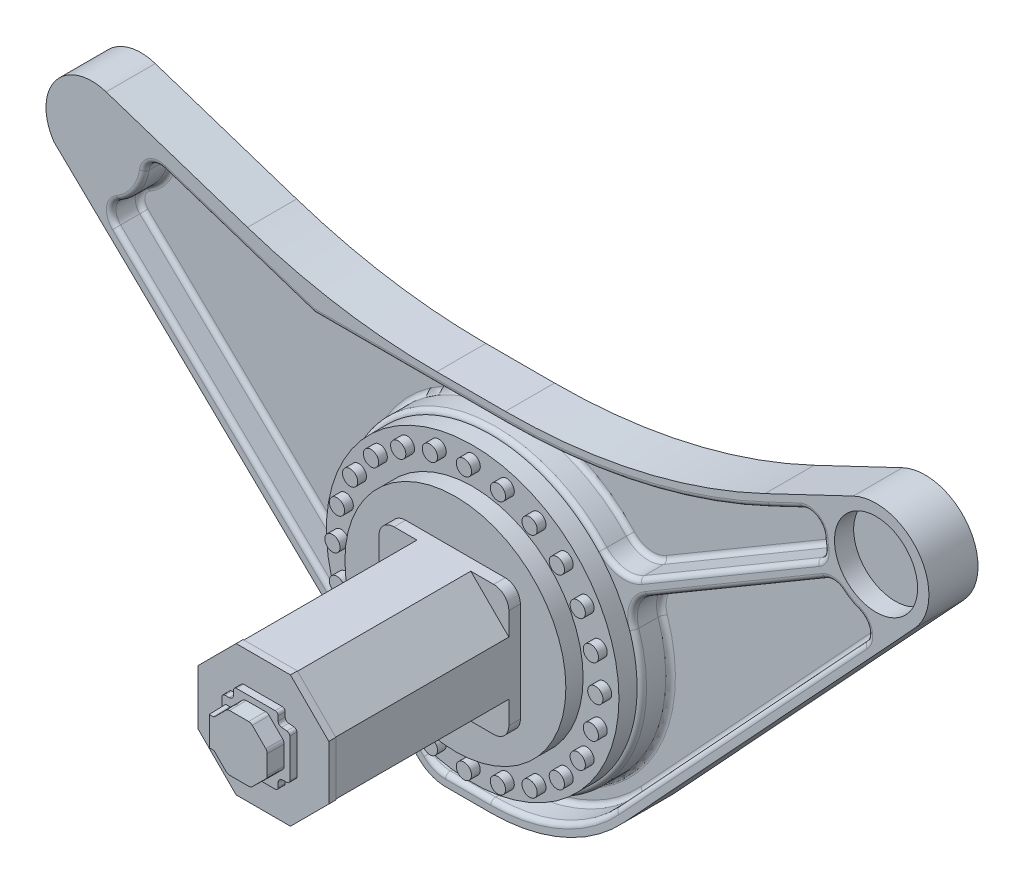
from build123d import *

# Parameters (mm, degrees)
BASE_EXTRUDE_DEPTH  = 65.024
CUT_EXTRUDE1_DEPTH  = 38.1
FILLET5_R           = 6.35
SKETCH6_R           = 193.675
BOSS_EXTRUDE1_DEPTH = 24.003
SKETCH7_R           = 146.26779464
BOSS_EXTRUDE2_DEPTH = 22.86
SKETCH11_R          = 55
CUT_EXTRUDE2_DEPTH  = 25.4
BOSS_EXTRUDE3_DEPTH = 15.24
BOSS_EXTRUDE4_DEPTH = 229.87
BOSS_EXTRUDE5_DEPTH = 9.2075
EXTRUDE1_DEPTH      = 9.365
EXTRUDE2_DEPTH      = 22.065
EXTRUDE2_DRAFT      = 1
SKETCH16_R          = 10.091495507
EXTRUDE3_DEPTH      = 11.5875


with BuildPart() as part:
    # Sketch4 → Base-Extrude (new body)
    with BuildSketch(Plane.XY):
        with BuildLine():
            Line((479.92086318, 363.207848646), (363.117312377, 307.623715754))
            ThreePointArc((363.117312377, 307.623715754), (195.563611931, 249.647162562), (19.354896086, 229.999981764))
            Line((19.354896086, 229.999981764), (-71.479066693, 229.999992346))
            ThreePointArc((-71.479066693, 229.999992346), (-198.372903258, 240.12789288), (-322.053822344, 270.255129416))
            Line((-322.053822344, 270.255129416), (-509.206847717, 331.980893447))
            ThreePointArc((-509.206847717, 331.980893447), (-576.71190566, 310.78827653), (-578.200740734, 240.050427892))
            Line((-578.200740734, 240.050427892), (-94.52402, -226.00512))
            ThreePointArc((-94.52402, -226.00512), (-78.535495562, -236.369472827), (-59.83063, -240))
            Line((-59.83063, -240), (0, -239.99999925))
            ThreePointArc((0, -239.99999925), (96.011991662, -219.958397661), (175.9887, -163.18081))
            Line((175.9887, -163.18081), (422.948954749, 103.163092303))
            Line((422.948954749, 103.163092303), (561.330058706, 252.405581829))
            ThreePointArc((561.330058706, 252.405581829), (566.410907567, 341.446427525), (479.92086318, 363.207848646))
        make_face()
    extrude(amount=-BASE_EXTRUDE_DEPTH)

    # Sketch5 → Cut-Extrude1 (cut)
    with BuildSketch(Plane.XY):
        with BuildLine():
            Line((-234.33637, 214.999997885), (19.354821885, 214.999997885))
            ThreePointArc((19.354821885, 214.999997885), (198.867420254, 235.015579287), (369.562720073, 294.079198307))
            Line((369.562720073, 294.079198307), (411.406245314, 313.991576975))
            ThreePointArc((411.406245314, 313.991576975), (430.352119032, 313.079278529), (440.073584256, 296.79211999))
            ThreePointArc((440.073584256, 296.79211999), (440.491819332, 291.71703301), (441.277901085, 286.685780292))
            ThreePointArc((441.277901085, 286.685780292), (439.868596399, 274.616540113), (431.75206941, 265.573604317))
            Line((431.75206941, 265.573604317), (197.134447916, 127.563319093))
            ThreePointArc((197.134447916, 127.563319093), (170.99853328, 122.498951147), (147.499655256, 135.010409423))
            ThreePointArc((147.499655256, 135.010409423), (-172.352272318, -101.383715715), (189.668329848, 63.323665965))
            ThreePointArc((189.668329848, 63.323665965), (190.150056495, 89.941362702), (207.274921456, 110.324513593))
            Line((207.274921456, 110.324513593), (441.93265, 248.35857))
            ThreePointArc((441.93265, 248.35857), (453.746209565, 251.049780264), (464.945711016, 246.426581209))
            ThreePointArc((464.945711016, 246.426581209), (474.991929524, 239.382873677), (486.113685369, 234.201477242))
            ThreePointArc((486.113685369, 234.201477242), (498.727804097, 220.106539526), (493.954743365, 201.803502844))
            Line((493.954743365, 201.803502844), (164.98941, -152.98201))
            ThreePointArc((164.98941, -152.98201), (90.011245295, -206.211001908), (0, -225.000000884))
            Line((0, -225.000000884), (-59.861446701, -224.99999781))
            ThreePointArc((-59.861446701, -224.99999781), (-72.940561236, -222.458413103), (-84.116, -215.20359))
            Line((-84.116, -215.20359), (-496.38324513, 182.744984508))
            ThreePointArc((-496.38324513, 182.744984508), (-502.371306157, 199.565803712), (-492.584434522, 214.499456218))
            ThreePointArc((-492.584434522, 214.499456218), (-470.010187221, 235.607651036), (-458.706327192, 264.371782834))
            ThreePointArc((-458.706327192, 264.371782834), (-449.360714295, 278.43629756), (-432.587227918, 280.385966672))
            Line((-432.587227918, 280.385966672), (-234.33637, 214.999997885))
        make_face()
    extrude(amount=-CUT_EXTRUDE1_DEPTH, mode=Mode.SUBTRACT)

    # Fillet5
    fillet5_edges = [part.edges().sort_by_distance(p)[0] for p in [
        (-172.352272318, -101.383715715, 0),
        (170.99853328, 122.498951147, 0),
        (314.443258663, 196.568461705, 0),
        (439.868596399, 274.616540113, 0),
        (440.491819332, 291.71703301, 0),
        (430.352119032, 313.079278529, 0),
        (390.484482693, 304.035387641, 0),
        (198.867420254, 235.015579287, 0),
        (-107.490774057, 214.999997885, 0),
        (-333.461798959, 247.692982278, 0),
        (-449.360714295, 278.43629756, 0),
        (-470.010187221, 235.607651036, 0),
        (-502.371306157, 199.565803712, 0),
        (-290.249622565, -16.229302746, 0),
        (-72.940561236, -222.458413103, 0),
        (-29.930723351, -224.999999347, 0),
        (90.011245295, -206.211001908, 0),
        (329.472076683, 24.410746422, 0),
        (498.727804097, 220.106539526, 0),
        (474.991929524, 239.382873677, 0),
        (453.746209565, 251.049780264, 0),
        (324.603785728, 179.341541797, 0),
        (190.150056495, 89.941362702, 0),
        (-172.352272318, -101.383715715, -38.1),
        (170.99853328, 122.498951147, -38.1),
        (314.443258663, 196.568461705, -38.1),
        (439.868596399, 274.616540113, -38.1),
        (440.491819332, 291.71703301, -38.1),
        (430.352119032, 313.079278529, -38.1),
        (390.484482693, 304.035387641, -38.1),
        (198.867420254, 235.015579287, -38.1),
        (-107.490774057, 214.999997885, -38.1),
        (-333.461798959, 247.692982278, -38.1),
        (-449.360714295, 278.43629756, -38.1),
        (-470.010187221, 235.607651036, -38.1),
        (-502.371306157, 199.565803712, -38.1),
        (-290.249622565, -16.229302746, -38.1),
        (-72.940561236, -222.458413103, -38.1),
        (-29.930723351, -224.999999347, -38.1),
        (90.011245295, -206.211001908, -38.1),
        (329.472076683, 24.410746422, -38.1),
        (498.727804097, 220.106539526, -38.1),
        (474.991929524, 239.382873677, -38.1),
        (453.746209565, 251.049780264, -38.1),
        (324.603785728, 179.341541797, -38.1),
        (190.150056495, 89.941362702, -38.1),
    ]]
    fillet(fillet5_edges, radius=FILLET5_R)

    # Sketch6 → Boss-Extrude1 (add)
    with BuildSketch(Plane.XY):
        with Locations(Location((0, 0, 0), (0, 0, 41.816695478))):
            Circle(SKETCH6_R)
    extrude(amount=BOSS_EXTRUDE1_DEPTH)

    # Sketch7 → Boss-Extrude2 (add)
    with BuildSketch(Plane.XY.offset(24.003)):
        Circle(SKETCH7_R)
    extrude(amount=BOSS_EXTRUDE2_DEPTH)

    # Sketch11 → Cut-Extrude2 (cut)
    with BuildSketch(Plane.XY):
        with Locations((510, 299.99994)):
            Circle(SKETCH11_R)
    extrude(amount=-CUT_EXTRUDE2_DEPTH, mode=Mode.SUBTRACT)

    # Sketch8 → Boss-Extrude3 (add)
    with BuildSketch(Plane.XY.offset(46.863)):
        with BuildLine():
            Line((66, 86), (-66, 86))
            ThreePointArc((-66, 86), (-80.142135624, 80.142135624), (-86, 66))
            Line((-86, 66), (-86, -66))
            ThreePointArc((-86, -66), (-80.142135624, -80.142135624), (-66, -86))
            Line((-66, -86), (66, -86))
            ThreePointArc((66, -86), (80.142135624, -80.142135624), (86, -66))
            Line((86, -66), (86, 66))
            ThreePointArc((86, 66), (80.142135624, 80.142135624), (66, 86))
        make_face()
    extrude(amount=BOSS_EXTRUDE3_DEPTH)

    # Sketch9 → Boss-Extrude4 (add)
    with BuildSketch(Plane.XY.offset(62.103)):
        Polygon((35.62236, 86), (-35.622370864, 85.9999955), (-86, 35.62236), (-85.9999955, -35.622370864), (-35.62236, -86), (35.622370864, -85.9999955), (86, -35.62236), (85.9999955, 35.622370864), align=None)
    extrude(amount=BOSS_EXTRUDE4_DEPTH)

    # Sketch10 → Boss-Extrude5 (add)
    with BuildSketch(Plane.XY.offset(291.973)):
        Polygon((86.76199548, 35.938001647), (35.937990686, 86.76200002), (-35.938001647, 86.76199548), (-86.76200002, 35.937990686), (-86.76199548, -35.938001647), (-35.937990686, -86.76200002), (35.938001647, -86.76199548), (86.76200002, -35.937990686), align=None)
    extrude(amount=BOSS_EXTRUDE5_DEPTH)

    # Sketch14 → Extrude1 (add)
    with BuildSketch(Plane.XY.offset(301.1805)):
        with BuildLine():
            Line((-25.98227798, 45.00069), (25.017722007, 45.00069))
            ThreePointArc((25.017722007, 45.00069), (27.842617628, 43.83264423), (29.017709564, 41.010672378))
            Line((29.017709564, 41.010672378), (29.032510523, 35.079864383))
            ThreePointArc((29.032510523, 35.079864383), (30.31733072, 31.736215204), (33.502448107, 30.097380248))
            Line((33.502448107, 30.097380248), (40.51772202, 29.50069))
            ThreePointArc((40.51772202, 29.50069), (43.24839841, 28.231366389), (44.51772202, 25.50069))
            Line((44.51772202, 25.50069), (44.51772202, -25.49931))
            ThreePointArc((44.51772202, -25.49931), (43.346149145, -28.327737125), (40.51772202, -29.49931))
            Line((40.51772202, -29.49931), (35.017722021, -29.49931))
            ThreePointArc((35.017722021, -29.49931), (30.775081333, -31.256669313), (29.01772202, -35.49931))
            Line((29.01772202, -35.49931), (29.01772202, -40.99931))
            ThreePointArc((29.01772202, -40.99931), (27.846149145, -43.827737125), (25.017722021, -44.99931))
            Line((25.017722021, -44.99931), (-25.98227798, -44.99931))
            ThreePointArc((-25.98227798, -44.99931), (-28.810705104, -43.827737125), (-29.98227798, -40.99931))
            Line((-29.98227798, -40.99931), (-29.98227798, -35.49931))
            ThreePointArc((-29.98227798, -35.49931), (-31.739637292, -31.256669313), (-35.98227798, -29.49931))
            Line((-35.98227798, -29.49931), (-41.482277979, -29.49931))
            ThreePointArc((-41.482277979, -29.49931), (-44.310705104, -28.327737125), (-45.48227798, -25.49931))
            Line((-45.48227798, -25.49931), (-45.48227798, 25.50069))
            ThreePointArc((-45.48227798, 25.50069), (-44.310705104, 28.329117125), (-41.482277979, 29.50069))
            Line((-41.482277979, 29.50069), (-35.98227798, 29.50069))
            ThreePointArc((-35.98227798, 29.50069), (-31.739637292, 31.258049313), (-29.98227798, 35.50069))
            Line((-29.98227798, 35.50069), (-29.98227798, 41.00069))
            ThreePointArc((-29.98227798, 41.00069), (-28.810705104, 43.829117125), (-25.98227798, 45.00069))
        make_face()
    extrude(amount=EXTRUDE1_DEPTH)


with BuildPart() as extrude2_tool:
    # Sketch15 → Extrude2 (with draft: the straight prism first)
    with BuildSketch(Plane.XY.offset(310.5455)):
        with BuildLine():
            ThreePointArc((-13.115850831, 37.50069), (-15.794624987, 36.967847278), (-18.06557798, 35.45044))
            Line((-18.06557798, 35.45044), (-33.722371198, 19.793583219))
            Line((-33.722371198, 19.793583219), (-35.01527798, 19.50069))
            Line((-35.01527798, 19.50069), (-40.48227798, 19.50069))
            Line((-40.48227798, 19.50069), (-40.48227798, -19.49931))
            Line((-40.48227798, -19.49931), (-34.429477983, -19.49931))
            Line((-34.429477983, -19.49931), (-33.722371198, -19.792203219))
            Line((-33.722371198, -19.792203219), (-18.06552679, -35.449056126))
            ThreePointArc((-18.06552679, -35.449056126), (-15.794562884, -36.966466364), (-13.115777981, -37.49931))
            Line((-13.115777981, -37.49931), (12.151228863, -37.49931))
            ThreePointArc((12.151228863, -37.49931), (14.830009728, -36.966466676), (17.100969488, -35.449057468))
            Line((17.100969488, -35.449057468), (34.967422019, -17.58257))
            ThreePointArc((34.967422019, -17.58257), (36.484866463, -15.311550296), (37.01772202, -12.632701086))
            Line((37.01772202, -12.632701086), (37.01772202, 12.634201959))
            ThreePointArc((37.01772202, 12.634201959), (36.484878733, 15.312985081), (34.967469489, 17.583947468))
            Line((34.967469489, 17.583947468), (17.10096812, 35.450438837))
            ThreePointArc((17.10096812, 35.450438837), (14.83000514, 36.967847098), (12.151221996, 37.50069))
            Line((12.151221996, 37.50069), (-13.115850831, 37.50069))
        make_face()
    extrude(amount=EXTRUDE2_DEPTH)
    # Extrude2: the draft: its side faces are tilted about the plane it starts from
    extrude2_sides = [extrude2_tool.faces().sort_by_distance(p)[0] for p in [
        (-15.794624987, 36.967847278, 321.578),
        (-25.893974589, 27.622011609, 321.578),
        (-34.368824589, 19.647136609, 321.578),
        (-37.74877798, 19.50069, 321.578),
        (-40.48227798, 0.00069, 321.578),
        (-37.455877981, -19.49931, 321.578),
        (-34.075924591, -19.64575661, 321.578),
        (-25.893948994, -27.620629672, 321.578),
        (-15.794562884, -36.966466364, 321.578),
        (-0.482274559, -37.49931, 321.578),
        (14.830009728, -36.966466676, 321.578),
        (26.034195753, -26.515813734, 321.578),
        (36.484866463, -15.311550296, 321.578),
        (37.01772202, 0.000750436, 321.578),
        (36.484878733, 15.312985081, 321.578),
        (26.034218804, 26.517193153, 321.578),
        (14.83000514, 36.967847098, 321.578),
        (-0.482314418, 37.50069, 321.578),
    ]]
    draft(extrude2_sides, Plane.XY.offset(310.5455), EXTRUDE2_DRAFT)


with BuildPart() as part_1:
    add(part.part)

    # Extrude2: add extrude2_tool
    add(extrude2_tool.part)

    # Sketch16 → Extrude3 (add)
    with BuildSketch(Plane.XY.offset(24.003)):
        with Locations((0.01622202, 174.00168)):
            Circle(SKETCH16_R)
        with Locations((45.050617932, 168.068517962)):
            Circle(SKETCH16_R)
        with Locations((87.014888682, 150.681764171)):
            Circle(SKETCH16_R)
        with Locations((123.049238566, 123.026297165)):
            Circle(SKETCH16_R)
        with Locations((150.697986191, 86.986791318)):
            Circle(SKETCH16_R)
        with Locations((168.076915097, 45.019279395)):
            Circle(SKETCH16_R)
        with Locations((174.00168, -0.01622202)):
            Circle(SKETCH16_R)
        with Locations((168.068517962, -45.050617932)):
            Circle(SKETCH16_R)
        with Locations((150.681764171, -87.014888682)):
            Circle(SKETCH16_R)
        with Locations((123.026297165, -123.049238566)):
            Circle(SKETCH16_R)
        with Locations((86.986791318, -150.697986191)):
            Circle(SKETCH16_R)
        with Locations((45.019279395, -168.076915097)):
            Circle(SKETCH16_R)
        with Locations((-0.01622202, -174.00168)):
            Circle(SKETCH16_R)
        with Locations((-45.050617932, -168.068517962)):
            Circle(SKETCH16_R)
        with Locations((-87.014888682, -150.681764171)):
            Circle(SKETCH16_R)
        with Locations((-123.049238566, -123.026297165)):
            Circle(SKETCH16_R)
        with Locations((-150.697986191, -86.986791318)):
            Circle(SKETCH16_R)
        with Locations((-168.076915097, -45.019279395)):
            Circle(SKETCH16_R)
        with Locations((-174.00168, 0.01622202)):
            Circle(SKETCH16_R)
        with Locations((-168.068517962, 45.050617932)):
            Circle(SKETCH16_R)
        with Locations((-150.681764171, 87.014888682)):
            Circle(SKETCH16_R)
        with Locations((-123.026297165, 123.049238566)):
            Circle(SKETCH16_R)
        with Locations((-86.986791318, 150.697986191)):
            Circle(SKETCH16_R)
        with Locations((-45.019279395, 168.076915097)):
            Circle(SKETCH16_R)
    extrude(amount=EXTRUDE3_DEPTH)


solid = part_1.part
